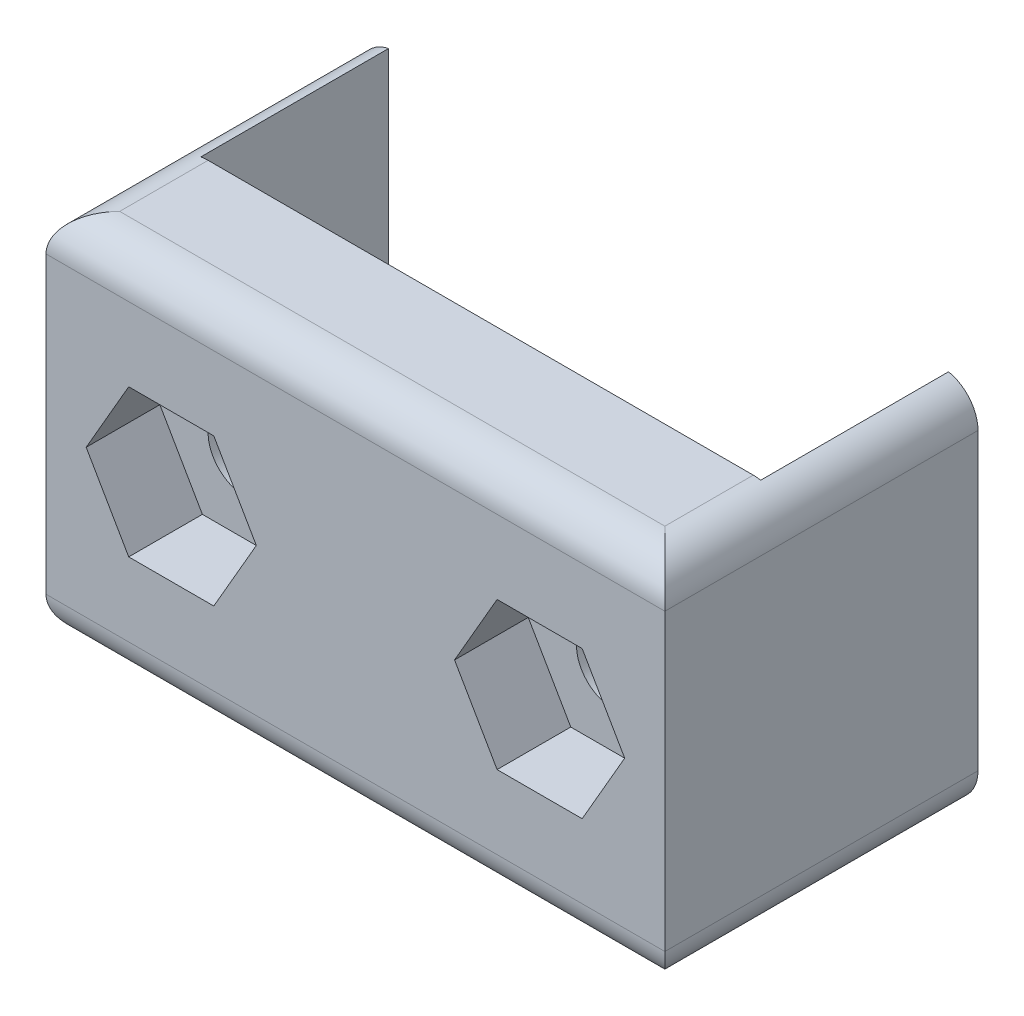
from build123d import *

# Parameters (mm, degrees)
BOSS_EXTRUDE1_DEPTH = 25.4
SKETCH2_R           = 2.54
CUT_EXTRUDE1_DEPTH  = 40.579199032
CUT_EXTRUDE2_DEPTH  = 5.08
FILLET1_R           = 2.54
FILLET2_R           = 2.54


with BuildPart() as part:
    # Sketch1 → Boss-Extrude1 (new body)
    with BuildSketch(Plane(origin=(0, 0, 0), x_dir=(1, 0, 0), z_dir=(0, 1, 0))):
        Polygon((-19.304, 0), (-21.336, 0), (-21.336, -21.59), (21.336, -21.59), (21.336, 0), (19.304, 0), (19.304, -12.954), (-19.304, -12.954), align=None)
    extrude(amount=BOSS_EXTRUDE1_DEPTH)

    # Sketch2 → Cut-Extrude1 (cut, through all)
    with BuildSketch(Plane.XY.offset(21.59)):
        with Locations((-12.7, 12.7)):
            Circle(SKETCH2_R)
        with Locations((12.7, 12.7)):
            Circle(SKETCH2_R)
    extrude(amount=-CUT_EXTRUDE1_DEPTH, mode=Mode.SUBTRACT)

    # Sketch3 → Cut-Extrude2 (cut)
    with BuildSketch(Plane.XY.offset(21.59)):
        Polygon((-9.767060633, 7.62), (-6.834121265, 12.7), (-9.767060633, 17.78), (-15.632939367, 17.78), (-18.565878735, 12.7), (-15.632939367, 7.62), align=None)
        Polygon((15.632939367, 7.62), (18.565878735, 12.7), (15.632939367, 17.78), (9.767060633, 17.78), (6.834121265, 12.7), (9.767060633, 7.62), align=None)
    extrude(amount=-CUT_EXTRUDE2_DEPTH, mode=Mode.SUBTRACT)

    # Fillet1
    fillet1_edges = [part.edges().sort_by_distance(p)[0] for p in [
        (-21.336, 25.4, 10.795),
        (21.336, 25.4, 10.795),
        (0, 25.4, 21.59),
    ]]
    fillet(fillet1_edges, radius=FILLET1_R)

    # Fillet2
    fillet2_edges = [part.edges().sort_by_distance(p)[0] for p in [
        (-21.336, 0, 10.795),
        (0, 0, 21.59),
        (21.336, 0, 10.795),
    ]]
    fillet(fillet2_edges, radius=FILLET2_R)


solid = part.part
